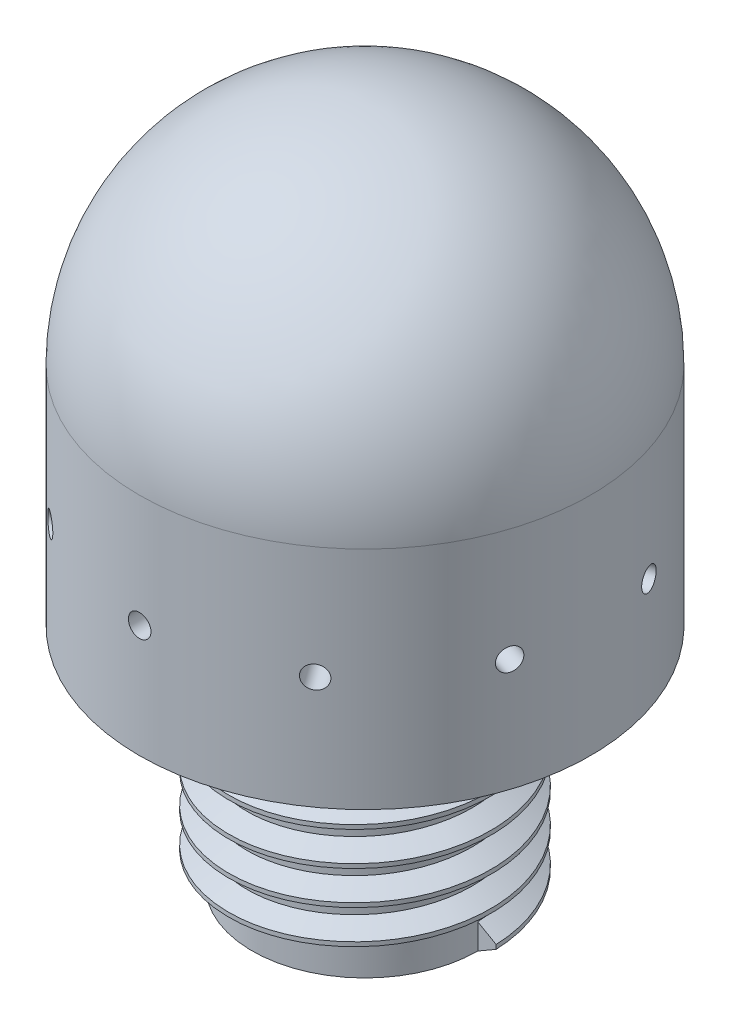
from build123d import *

# Parameters (mm, degrees)
SKETCH2_R               = 10
BOSS_EXTRUDE1_DEPTH     = 20
FILLET1_R               = 10
SKETCH3_R               = 5
BOSS_EXTRUDE2_DEPTH     = 10
SKETCH4_R               = 2
CUT_EXTRUDE1_DEPTH      = 20
CUT_EXTRUDE2_REACH      = 32
CUT_EXTRUDE2_END_RADIUS = 2
SKETCH5_R               = 0.5
CIRPATTERN1_COUNT       = 10
THREAD1_PITCH           = 1.5


with BuildPart() as part:
    # Sketch2 → Boss-Extrude1 (new body)
    with BuildSketch(Plane(origin=(0, 0, 0), x_dir=(1, 0, 0), z_dir=(0, 1, 0))):
        with Locations(Location((0, 0, 0), (0, 0, 270))):
            Circle(SKETCH2_R)
    extrude(amount=BOSS_EXTRUDE1_DEPTH)

    # Fillet1
    fillet1_edges = [part.edges().sort_by_distance(p)[0] for p in [
        (0, 20, -10),
    ]]
    fillet(fillet1_edges, radius=FILLET1_R)

    # Sketch3 → Boss-Extrude2 (add)
    with BuildSketch(Plane.XZ):
        with Locations(Location((0, 0, 0), (0, 0, 270))):
            Circle(SKETCH3_R)
    extrude(amount=BOSS_EXTRUDE2_DEPTH)

    # Sketch4 → Cut-Extrude1 (cut)
    with BuildSketch(Plane.XZ.offset(10)):
        with Locations(Location((0, 0, 0), (0, 0, 270))):
            Circle(SKETCH4_R)
    extrude(amount=-CUT_EXTRUDE1_DEPTH, mode=Mode.SUBTRACT)

    # Cut-Extrude2: up to this cylinder (the profile starts outside it)
    cut_extrude2_end = Plane(origin=(0, 5, 0), z_dir=(0, -1, 0)) * Cylinder(CUT_EXTRUDE2_END_RADIUS, 69, mode=Mode.PRIVATE)
    # Sketch5 → Cut-Extrude2 (cut, up to the surface)
    with BuildSketch(Plane(origin=(0, 0, 10), x_dir=(-1, 0, 0), z_dir=(0, 0, -1)), mode=Mode.PRIVATE) as cut_extrude2_sk1:
        with Locations(Location((0, 5, 0), (0, 0, 180))):
            Circle(SKETCH5_R)
    cut_extrude2_tool1 = extrude(cut_extrude2_sk1.sketch, amount=CUT_EXTRUDE2_REACH, mode=Mode.PRIVATE) - cut_extrude2_end
    cut_extrude2 = cut_extrude2_tool1.solids().sort_by_distance((0, 5, 10))[0]
    add(cut_extrude2, mode=Mode.SUBTRACT)

    # CirPattern1: Cut-Extrude2 ×10 about axis
    cirpattern1_axis = Axis((0, 20, 0), (0, -1, 0))
    for i in range(1, CIRPATTERN1_COUNT):
        add(cut_extrude2.rotate(cirpattern1_axis, i * 360 / CIRPATTERN1_COUNT), mode=Mode.SUBTRACT)

    # Thread1: the profile of Thread Profile1 profile screwed along a right-hand helix of 6.666667 turns, 8 arcs to a turn; built about Z, then put on its axis
    thread1_z = Axis((0, 0, 0), (0, 0, 1))
    thread1_corners = [(4.9997, 0, -0.000173205), (5.811898812, 0, 0.468749998), (5.811898812, 0, 0.656249998), (4.9997, 0, 1.125173201)]
    with BuildLine(mode=Mode.PRIVATE) as thread1_profile:
        Line(thread1_corners[0], thread1_corners[1])
        Line(thread1_corners[1], thread1_corners[2])
        Line(thread1_corners[2], thread1_corners[3])
        Line(thread1_corners[3], thread1_corners[0])
    thread1_cap = Face(thread1_profile.wire())
    thread1_turn_angles = [0, 22.5, 45, 67.5, 90, 112.5, 135, 157.5, 180, 202.5, 225, 247.5, 270, 292.5, 315, 337.5, 360]
    thread1_turn_weights = [1, 0.9238795325112867, 1, 0.9238795325112867, 1, 0.9238795325112867, 1, 0.9238795325112867, 1, 0.9238795325112867, 1, 0.9238795325112867, 1, 0.9238795325112867, 1, 0.9238795325112867, 1]
    thread1_turn_rails = [Edge.make_bspline([Vector(p[0], p[1], 0).rotate(thread1_z, thread1_turn_angles[k]) / thread1_turn_weights[k] + Vector(0, 0, p[2] + THREAD1_PITCH * thread1_turn_angles[k] / 360) for k in range(17)], [0, 0, 0, 1, 1, 2, 2, 3, 3, 4, 4, 5, 5, 6, 6, 7, 7, 8, 8, 8], 2, thread1_turn_weights) for p in thread1_corners]
    thread1_turn_sides = [Face.make_surface_from_curves(thread1_turn_rails[p[0]], thread1_turn_rails[p[1]]) for p in [(0, 1), (1, 2), (2, 3), (3, 0)]]
    thread1_last_angles = [2160, 2182.5, 2205, 2227.5, 2250, 2272.5, 2295, 2317.5, 2340, 2362.5, 2385, 2392.5, 2400]
    thread1_last_weights = [1, 0.9238795325112867, 1, 0.9238795325112867, 1, 0.9238795325112867, 1, 0.9238795325112867, 1, 0.9238795325112867, 1, 0.9914448613738109, 1]
    thread1_last_rails = [Edge.make_bspline([Vector(p[0], p[1], 0).rotate(thread1_z, thread1_last_angles[k]) / thread1_last_weights[k] + Vector(0, 0, p[2] + THREAD1_PITCH * thread1_last_angles[k] / 360) for k in range(13)], [0, 0, 0, 1, 1, 2, 2, 3, 3, 4, 4, 5, 5, 6, 6, 6], 2, thread1_last_weights) for p in thread1_corners]
    thread1_last_sides = [Face.make_surface_from_curves(thread1_last_rails[p[0]], thread1_last_rails[p[1]]) for p in [(0, 1), (1, 2), (2, 3), (3, 0)]]
    thread1 = Plane(origin=(0, -10, 0), x_dir=(1, 0, 0), z_dir=(0, 1, 0)) * Solid(Shell([*[p.moved(Location((0, 0, THREAD1_PITCH * i))) for i in range(6) for p in thread1_turn_sides], *thread1_last_sides, thread1_cap, thread1_cap.rotate(thread1_z, 2400).moved(Location((0, 0, THREAD1_PITCH * 2400 / 360)))]))
    add(thread1)


solid = part.part
